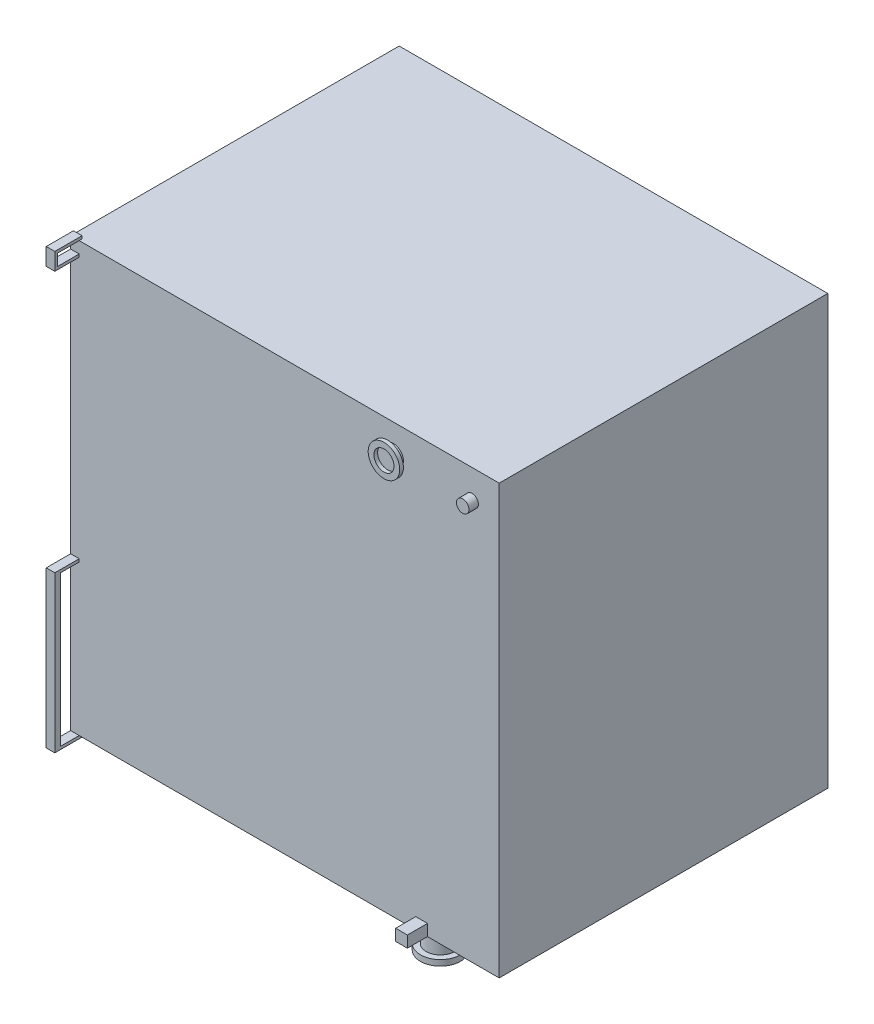
from build123d import *

# Parameters (mm, degrees)
SKETCH1_W           = 1500
SKETCH1_H           = 1500
BOSS_EXTRUDE1_DEPTH = 1150
EXTRUDE_THIN2_START = -30
EXTRUDE_THIN2_DEPTH = 30
SKETCH3_W           = 41.026330883
SKETCH3_H           = 1220.330091563
BOSS_EXTRUDE2_DEPTH = 40
SKETCH4_R           = 50
BOSS_EXTRUDE3_DEPTH = 70
SKETCH5_R           = 70
SKETCH5_R_2         = 50
BOSS_EXTRUDE4_DEPTH = 20
SKETCH6_R           = 35.15798367
BOSS_EXTRUDE5_DEPTH = 20
SKETCH7_R           = 55.15798367
SKETCH7_R_2         = 35.15798367
BOSS_EXTRUDE6_DEPTH = 13
SKETCH8_R           = 21.964256975
BOSS_EXTRUDE7_DEPTH = 33


# Read off the part's stored shape, not the designer's step: Extrude-Thin2
with BuildPart() as part:
    # Sketch1 → Boss-Extrude1 (new body)
    with BuildSketch(Plane.XY):
        with Locations((-607.391304348, -38.695652174)):
            Rectangle(SKETCH1_W, SKETCH1_H)
    extrude(amount=BOSS_EXTRUDE1_DEPTH)

    # Extrude-Thin2 outline → Extrude-Thin2 (add)
    with BuildSketch(Plane.ZY.offset(1357.391304348).offset(EXTRUDE_THIN2_START)):
        Polygon((1140, 721.304347826), (1140, 711.304347826), (1225.313853743, 711.304347826), (1225.313853743, 670.922038878), (1150, 670.922038878), (1150, 660.922038878), (1235.313853743, 660.922038878), (1235.313853743, 721.304347826), align=None)
        Polygon((0, -788.695652174), (0, -252.776990358), (-10, -252.776990358), (-10, -798.695652174), (1235.313853743, -798.695652174), (1235.313853743, -252.776990358), (1150, -252.776990358), (1150, -262.776990358), (1215.313853743, -262.776990358), (1215.313853743, -788.695652174), align=None)
    extrude(amount=EXTRUDE_THIN2_DEPTH)

    # Sketch3 → Boss-Extrude2 (add)
    with BuildSketch(Plane.XZ.offset(788.695652174)):
        with Locations((-128.892214668, 610.165045781)):
            Rectangle(SKETCH3_W, SKETCH3_H)
    extrude(amount=-BOSS_EXTRUDE2_DEPTH)

    # Sketch4 → Boss-Extrude3 (add)
    with BuildSketch(Plane.XZ.offset(788.695652174)):
        with Locations(Location((-135.376748929, 1077.57144651, 0), (0, 0, 90))):
            Circle(SKETCH4_R)
    extrude(amount=BOSS_EXTRUDE3_DEPTH)

    # Sketch6 → Boss-Extrude5 (add)
    with BuildSketch(Plane.XY.offset(1150)):
        with Locations((-227.721378389, 611.304347826)):
            Circle(SKETCH6_R)
    extrude(amount=BOSS_EXTRUDE5_DEPTH)

    # Sketch8 → Boss-Extrude7 (add)
    with BuildSketch(Plane.XY.offset(1150)):
        with Locations((47.971393261, 610.858453258)):
            Circle(SKETCH8_R)
    extrude(amount=BOSS_EXTRUDE7_DEPTH)


with BuildPart() as body_2:
    # Sketch5 → Boss-Extrude4 (new body)
    with BuildSketch(Plane.XZ.offset(858.695652174)):
        with Locations(Location((-135.376748929, 1077.57144651, 0), (0, 0, 270))):
            Circle(SKETCH5_R)
        with Locations(Location((-135.376748929, 1077.57144651, 0), (0, 0, 270))):
            Circle(SKETCH5_R_2, mode=Mode.SUBTRACT)
    extrude(amount=BOSS_EXTRUDE4_DEPTH)


with BuildPart() as body_3:
    # Sketch7 → Boss-Extrude6 (new body)
    with BuildSketch(Plane.XY.offset(1170)):
        with Locations((-227.721378389, 611.304347826)):
            Circle(SKETCH7_R)
        with Locations((-227.721378389, 611.304347826)):
            Circle(SKETCH7_R_2, mode=Mode.SUBTRACT)
    extrude(amount=BOSS_EXTRUDE6_DEPTH)


solid = Compound([part.part, body_2.part, body_3.part])
